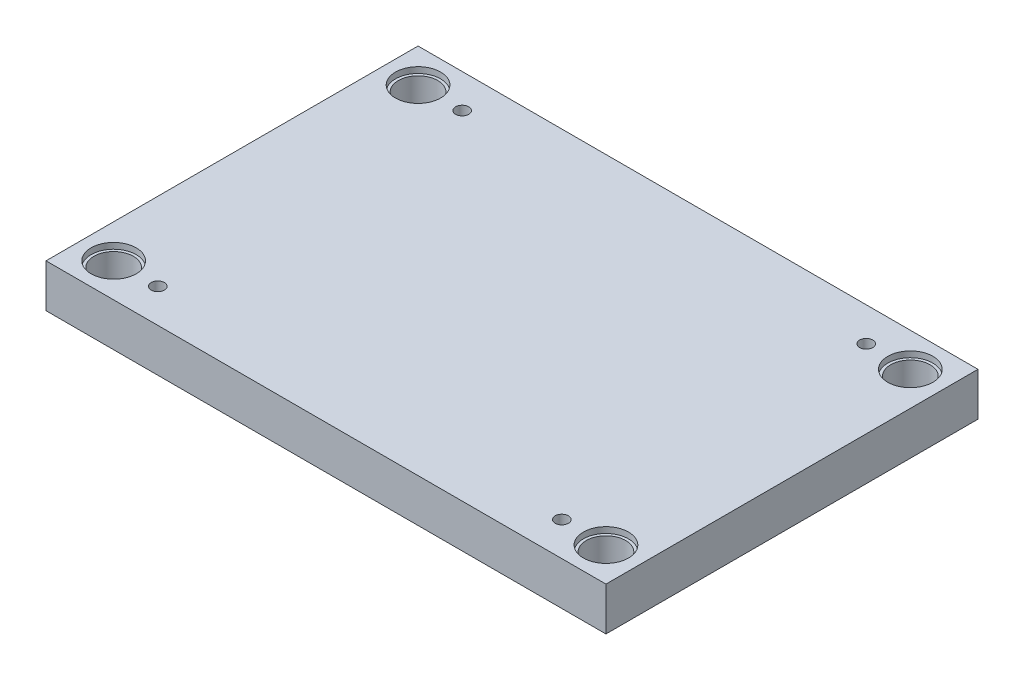
from build123d import *

# Parameters (mm, degrees)
SZKIC1_W                    = 596
SZKIC1_H                    = 396
SZKIC1_R                    = 24
SZKIC1_R_2                  = 21
DODANIE_WYCI_GNI_CIE1_DEPTH = 46
SZKIC1_3_R                  = 24
SZKIC1_3_R_2                = 21
WYTNIJ_WYCI_GNI_CIE1_DEPTH  = 6.3
OTW_R_GWINTOWANY_M161_D     = 14
OTW_R_GWINTOWANY_M161_DEPTH = 40
OTW_R_GWINTOWANY_M161_TIP   = 4.206024333
SZKIC4_W                    = 250.46
SZKIC4_H                    = 3
SZKIC4_7_W                  = 70
SZKIC4_7_H                  = 3
SZKIC9_R                    = 3
LUSTRO2_COPY_1_SKETCH_R     = 3
LUSTRO3_COPY_1_SKETCH_R     = 3
LUSTRO3_COPY_2_SKETCH_W     = 70
LUSTRO3_COPY_2_SKETCH_H     = 3
LUSTRO3_COPY_5_SKETCH_R     = 3
LUSTRO3_COPY_6_SKETCH_R     = 3
WYTNIJ_WYCI_GNI_CIE2_DEPTH  = 0.75
WYTNIJ_WYCI_GNI_CIE8_DEPTH  = 2.75
DODANIE_WYCI_GNI_CIE2_START = 11.25
SZKIC10_7_R                 = 5.5
DODANIE_WYCI_GNI_CIE2_DEPTH = 11.25
SZKIC10_8_R                 = 5
DODANIE_WYCI_GNI_CIE3_DEPTH = 6.25
ZAOKR_GLENIE1_R             = 1
ZAOKR_GLENIE1_OF_LUSTRO6_R  = 1


# Read off the part's stored shape, not the designer's step: Lustro7, Lustro8
with BuildPart() as part:
    # Szkic1 → Dodanie-wyciągnięcie1 (new body)
    # profile 1 of 5: a face of its own
    with BuildSketch(Plane(origin=(0, 0, 0), x_dir=(1, 0, 0), z_dir=(0, 1, 0))):
        with Locations((298, 198)):
            Rectangle(SZKIC1_W, SZKIC1_H)
        with Locations((560, 360)):
            Circle(SZKIC1_R, mode=Mode.SUBTRACT)
        with Locations((36, 360)):
            Circle(SZKIC1_R, mode=Mode.SUBTRACT)
        with Locations((560, 36)):
            Circle(SZKIC1_R, mode=Mode.SUBTRACT)
        with Locations((36, 36)):
            Circle(SZKIC1_R, mode=Mode.SUBTRACT)
    # profile 2 of 5: a face of its own
    with BuildSketch(Plane(origin=(0, 0, 0), x_dir=(1, 0, 0), z_dir=(0, 1, 0))):
        with Locations((36, 36)):
            Circle(SZKIC1_R)
        with Locations(Location((36, 36, 0), (0, 0, 270))):
            Circle(SZKIC1_R_2, mode=Mode.SUBTRACT)
    # profile 3 of 5: a face of its own
    with BuildSketch(Plane(origin=(0, 0, 0), x_dir=(1, 0, 0), z_dir=(0, 1, 0))):
        with Locations((560, 36)):
            Circle(SZKIC1_R)
        with Locations(Location((560, 36, 0), (0, 0, 270))):
            Circle(SZKIC1_R_2, mode=Mode.SUBTRACT)
    # profile 4 of 5: a face of its own
    with BuildSketch(Plane(origin=(0, 0, 0), x_dir=(1, 0, 0), z_dir=(0, 1, 0))):
        with Locations((560, 360)):
            Circle(SZKIC1_R)
        with Locations(Location((560, 360, 0), (0, 0, 270))):
            Circle(SZKIC1_R_2, mode=Mode.SUBTRACT)
    # profile 5 of 5: a face of its own
    with BuildSketch(Plane(origin=(0, 0, 0), x_dir=(1, 0, 0), z_dir=(0, 1, 0))):
        with Locations((36, 360)):
            Circle(SZKIC1_R)
        with Locations(Location((36, 360, 0), (0, 0, 270))):
            Circle(SZKIC1_R_2, mode=Mode.SUBTRACT)
    extrude(amount=-DODANIE_WYCI_GNI_CIE1_DEPTH)

    # Szkic1<3> → Wytnij-wyciągnięcie1 (cut)
    # profile 1 of 4: a face of its own
    with BuildSketch(Plane(origin=(0, 0, 0), x_dir=(1, 0, 0), z_dir=(0, 1, 0))):
        with Locations(Location((36, 360, 0), (0, 0, 270))):
            Circle(SZKIC1_3_R)
        with Locations(Location((36, 360, 0), (0, 0, 270))):
            Circle(SZKIC1_3_R_2, mode=Mode.SUBTRACT)
    # profile 2 of 4: a face of its own
    with BuildSketch(Plane(origin=(0, 0, 0), x_dir=(1, 0, 0), z_dir=(0, 1, 0))):
        with Locations(Location((36, 36, 0), (0, 0, 270))):
            Circle(SZKIC1_3_R)
        with Locations(Location((36, 36, 0), (0, 0, 270))):
            Circle(SZKIC1_3_R_2, mode=Mode.SUBTRACT)
    # profile 3 of 4: a face of its own
    with BuildSketch(Plane(origin=(0, 0, 0), x_dir=(1, 0, 0), z_dir=(0, 1, 0))):
        with Locations(Location((560, 36, 0), (0, 0, 270))):
            Circle(SZKIC1_3_R)
        with Locations(Location((560, 36, 0), (0, 0, 270))):
            Circle(SZKIC1_3_R_2, mode=Mode.SUBTRACT)
    # profile 4 of 4: a face of its own
    with BuildSketch(Plane(origin=(0, 0, 0), x_dir=(1, 0, 0), z_dir=(0, 1, 0))):
        with Locations(Location((560, 360, 0), (0, 0, 270))):
            Circle(SZKIC1_3_R)
        with Locations(Location((560, 360, 0), (0, 0, 270))):
            Circle(SZKIC1_3_R_2, mode=Mode.SUBTRACT)
    extrude(amount=-WYTNIJ_WYCI_GNI_CIE1_DEPTH, mode=Mode.SUBTRACT)

    # Otwór gwintowany M161
    with Locations(Plane(origin=(83, 0, -360), x_dir=(0, 0, 1), z_dir=(0, 1, 0))):
        with Locations((0, 0), (0, 430), (324, 0), (324, 430)):
            Hole(OTW_R_GWINTOWANY_M161_D / 2, depth=OTW_R_GWINTOWANY_M161_DEPTH)
            with Locations((0, 0, -(OTW_R_GWINTOWANY_M161_DEPTH + OTW_R_GWINTOWANY_M161_TIP / 2))):  # 118° drill point
                Cone(0, OTW_R_GWINTOWANY_M161_D / 2, OTW_R_GWINTOWANY_M161_TIP, mode=Mode.SUBTRACT)

    # Szkic4 → Wycięcie-obrót4 (revolve, cut)
    with BuildSketch(Plane.XZ.offset(46)):
        with Locations((298, -196.5)):
            Rectangle(SZKIC4_W, SZKIC4_H)
    revolve(axis=Axis((423.23, -46, -198), (-1, 0, 0)), mode=Mode.SUBTRACT)

    # Szkic4<6> → Wycięcie-obrót5 (revolve, cut)
    with BuildSketch(Plane.XZ.offset(46)):
        Polygon((423.23, -195), (423.23, -198), (423.23, -218), (426.23, -218), (426.23, -178), (423.23, -178), align=None)
    wyci_cie_obr_t5 = revolve(axis=Axis((423.23, -46, -218), (0, 0, 1)), mode=Mode.SUBTRACT)

    # Szkic4<7> → Wycięcie-obrót6 (revolve, cut)
    with BuildSketch(Plane.XZ.offset(46)):
        with Locations((423.23, -176.5)):
            Rectangle(SZKIC4_7_W, SZKIC4_7_H)
    wyci_cie_obr_t6 = revolve(axis=Axis((458.23, -46, -178), (-1, 0, 0)), mode=Mode.SUBTRACT)

    # Szkic4<8> → Wycięcie-obrót7 (revolve, cut)
    with BuildSketch(Plane.XZ.offset(46)):
        Polygon((380.23, -153), (382.48, -147), (383.23, -147), (383.23, -153), (383.23, -173), (380.23, -173), align=None)
    wyci_cie_obr_t7 = revolve(axis=Axis((383.23, -46, -153), (0, 0, -1)), mode=Mode.SUBTRACT)

    # Szkic4<9> → Wycięcie-obrót8 (revolve, cut)
    with BuildSketch(Plane.XZ.offset(46)):
        Polygon((466.23, -173), (463.23, -173), (463.23, -153), (463.23, -147), (463.98, -147), (466.23, -153), align=None)
    wyci_cie_obr_t8 = revolve(axis=Axis((463.23, -46, -153), (0, 0, -1)), mode=Mode.SUBTRACT)

    # Wycięcie-wyciągnięcie po ścieżce1: sweep along a path in Szkic8
    with BuildLine(Plane.XZ.offset(46)) as wyci_cie_wyci_gni_cie_po_cie_ce1_path:
        ThreePointArc((383.23, -173), (384.694466094, -176.535533906), (388.23, -178))
    # Szkic9 → Wycięcie-wyciągnięcie po ścieżce1 (sweep, cut)
    with BuildSketch(Plane(origin=(388.23, 0, 0), x_dir=(0, 0, -1), z_dir=(1, 0, 0))):
        with Locations((178, -46)):
            Circle(SZKIC9_R)
    wyci_cie_wyci_gni_cie_po_cie_ce1 = sweep(path=wyci_cie_wyci_gni_cie_po_cie_ce1_path.line, mode=Mode.SUBTRACT)

    # Lustro1: Wycięcie-wyciągnięcie po ścieżce1 across plane
    add(wyci_cie_wyci_gni_cie_po_cie_ce1.mirror(Plane(origin=(423.23, 0, 0), x_dir=(0, 0, 1), z_dir=(1, 0, 0))), mode=Mode.SUBTRACT)

    # Lustro2: Wycięcie-obrót6, Wycięcie-obrót7, Wycięcie-obrót8, Wycięcie-wyciągnięcie po ścieżce1 across plane
    add(wyci_cie_obr_t6.mirror(Plane(origin=(0, 0, -198), x_dir=(1, 0, 0), z_dir=(0, 0, -1))), mode=Mode.SUBTRACT)
    add(wyci_cie_obr_t7.mirror(Plane(origin=(0, 0, -198), x_dir=(1, 0, 0), z_dir=(0, 0, -1))), mode=Mode.SUBTRACT)
    add(wyci_cie_obr_t8.mirror(Plane(origin=(0, 0, -198), x_dir=(1, 0, 0), z_dir=(0, 0, -1))), mode=Mode.SUBTRACT)
    add(wyci_cie_wyci_gni_cie_po_cie_ce1.mirror(Plane(origin=(0, 0, -198), x_dir=(1, 0, 0), z_dir=(0, 0, -1))), mode=Mode.SUBTRACT)

    # Lustro2 copy 1: sweep along a path in Lustro2 copy 1 path
    with BuildLine(Plane(origin=(846.46, -46, -396), x_dir=(-1, 0, 0), z_dir=(0, -1, 0))) as lustro2_copy_1_path:
        ThreePointArc((383.23, -173), (384.694466094, -176.535533906), (388.23, -178))
    # Lustro2 copy 1 sketch → Lustro2 copy 1 (sweep, cut)
    with BuildSketch(Plane(origin=(458.23, 0, -396), x_dir=(0, 0, 1), z_dir=(-1, 0, 0))):
        with Locations((178, -46)):
            Circle(LUSTRO2_COPY_1_SKETCH_R)
    sweep(path=lustro2_copy_1_path.line, mode=Mode.SUBTRACT)

    # Lustro3: Wycięcie-obrót5, Wycięcie-obrót6, Wycięcie-obrót7, Wycięcie-obrót8, Wycięcie-wyciągnięcie po ścieżce1 across plane
    add(wyci_cie_obr_t5.mirror(Plane.ZY.offset(-298)), mode=Mode.SUBTRACT)
    add(wyci_cie_obr_t6.mirror(Plane.ZY.offset(-298)), mode=Mode.SUBTRACT)
    add(wyci_cie_obr_t7.mirror(Plane.ZY.offset(-298)), mode=Mode.SUBTRACT)
    add(wyci_cie_obr_t8.mirror(Plane.ZY.offset(-298)), mode=Mode.SUBTRACT)
    add(wyci_cie_wyci_gni_cie_po_cie_ce1.mirror(Plane.ZY.offset(-298)), mode=Mode.SUBTRACT)

    # Lustro3 copy 1: sweep along a path in Lustro3 copy 1 path
    with BuildLine(Plane(origin=(-250.46, -46, 0), x_dir=(1, 0, 0), z_dir=(0, -1, 0))) as lustro3_copy_1_path:
        ThreePointArc((383.23, -173), (384.694466094, -176.535533906), (388.23, -178))
    # Lustro3 copy 1 sketch → Lustro3 copy 1 (sweep, cut)
    with BuildSketch(Plane(origin=(137.77, 0, 0), x_dir=(0, 0, -1), z_dir=(1, 0, 0))):
        with Locations((178, -46)):
            Circle(LUSTRO3_COPY_1_SKETCH_R)
    sweep(path=lustro3_copy_1_path.line, mode=Mode.SUBTRACT)

    # Lustro3 copy 2 sketch → Lustro3 copy 2 (revolve, cut)
    with BuildSketch(Plane(origin=(596, -46, -396), x_dir=(-1, 0, 0), z_dir=(0, -1, 0))):
        with Locations((423.23, -176.5)):
            Rectangle(LUSTRO3_COPY_2_SKETCH_W, LUSTRO3_COPY_2_SKETCH_H)
    revolve(axis=Axis((137.77, -46, -218), (1, 0, 0)), mode=Mode.SUBTRACT)

    # Lustro3 copy 3 sketch → Lustro3 copy 3 (revolve, cut)
    with BuildSketch(Plane(origin=(596, -46, -396), x_dir=(-1, 0, 0), z_dir=(0, -1, 0))):
        Polygon((380.23, -153), (382.48, -147), (383.23, -147), (383.23, -153), (383.23, -173), (380.23, -173), align=None)
    revolve(axis=Axis((212.77, -46, -243), (0, 0, 1)), mode=Mode.SUBTRACT)

    # Lustro3 copy 4 sketch → Lustro3 copy 4 (revolve, cut)
    with BuildSketch(Plane(origin=(596, -46, -396), x_dir=(-1, 0, 0), z_dir=(0, -1, 0))):
        Polygon((466.23, -173), (463.23, -173), (463.23, -153), (463.23, -147), (463.98, -147), (466.23, -153), align=None)
    revolve(axis=Axis((132.77, -46, -243), (0, 0, 1)), mode=Mode.SUBTRACT)

    # Lustro3 copy 5: sweep along a path in Lustro3 copy 5 path
    with BuildLine(Plane(origin=(596, -46, -396), x_dir=(-1, 0, 0), z_dir=(0, -1, 0))) as lustro3_copy_5_path:
        ThreePointArc((383.23, -173), (384.694466094, -176.535533906), (388.23, -178))
    # Lustro3 copy 5 sketch → Lustro3 copy 5 (sweep, cut)
    with BuildSketch(Plane(origin=(207.77, 0, -396), x_dir=(0, 0, 1), z_dir=(-1, 0, 0))):
        with Locations((178, -46)):
            Circle(LUSTRO3_COPY_5_SKETCH_R)
    sweep(path=lustro3_copy_5_path.line, mode=Mode.SUBTRACT)

    # Lustro3 copy 6: sweep along a path in Lustro3 copy 6 path
    with BuildLine(Plane(origin=(-250.46, -46, -396), x_dir=(1, 0, 0), z_dir=(0, -1, 0))) as lustro3_copy_6_path:
        ThreePointArc((383.23, 173), (384.694466094, 176.535533906), (388.23, 178))
    # Lustro3 copy 6 sketch → Lustro3 copy 6 (sweep, cut)
    with BuildSketch(Plane(origin=(137.77, 0, -396), x_dir=(0, 0, 1), z_dir=(1, 0, 0))):
        with Locations((178, 46)):
            Circle(LUSTRO3_COPY_6_SKETCH_R)
    sweep(path=lustro3_copy_6_path.line, mode=Mode.SUBTRACT)

    # Szkic10 → Wytnij-wyciągnięcie2 (cut)
    with BuildSketch(Plane(origin=(0, -46, 0), x_dir=(-1, 0, 0), z_dir=(0, -1, 0))):
        with BuildLine():
            Line((-483.73, 257.65), (-483.73, 310.35))
            ThreePointArc((-483.73, 310.35), (-481.196473657, 316.466473657), (-475.08, 319))
            Line((-475.08, 319), (-451.38, 319))
            ThreePointArc((-451.38, 319), (-445.263526343, 316.466473657), (-442.73, 310.35))
            Line((-442.73, 310.35), (-442.73, 257.65))
            ThreePointArc((-442.73, 257.65), (-445.263526343, 251.533526343), (-451.38, 249))
            Line((-451.38, 249), (-475.08, 249))
            ThreePointArc((-475.08, 249), (-481.196473657, 251.533526343), (-483.73, 257.65))
        make_face()
        with BuildLine():
            Line((-475.08, 249.5), (-451.38, 249.5))
            ThreePointArc((-451.38, 249.5), (-445.617079733, 251.887079733), (-443.23, 257.65))
            Line((-443.23, 257.65), (-443.23, 310.35))
            ThreePointArc((-443.23, 310.35), (-445.617079733, 316.112920267), (-451.38, 318.5))
            Line((-451.38, 318.5), (-475.08, 318.5))
            ThreePointArc((-475.08, 318.5), (-480.842920267, 316.112920267), (-483.23, 310.35))
            Line((-483.23, 310.35), (-483.23, 257.65))
            ThreePointArc((-483.23, 257.65), (-480.842920267, 251.887079733), (-475.08, 249.5))
        make_face(mode=Mode.SUBTRACT)
    wytnij_wyci_gni_cie2 = extrude(amount=-WYTNIJ_WYCI_GNI_CIE2_DEPTH, mode=Mode.SUBTRACT)

    # Szkic10<6> → Wytnij-wyciągnięcie8 (cut)
    with BuildSketch(Plane(origin=(0, -46, 0), x_dir=(-1, 0, 0), z_dir=(0, -1, 0))):
        with BuildLine():
            ThreePointArc((-451.38, 318.5), (-445.617079733, 316.112920267), (-443.23, 310.35))
            Line((-443.23, 310.35), (-443.23, 257.65))
            ThreePointArc((-443.23, 257.65), (-445.617079733, 251.887079733), (-451.38, 249.5))
            Line((-451.38, 249.5), (-475.08, 249.5))
            ThreePointArc((-475.08, 249.5), (-480.842920267, 251.887079733), (-483.23, 257.65))
            Line((-483.23, 257.65), (-483.23, 310.35))
            ThreePointArc((-483.23, 310.35), (-480.842920267, 316.112920267), (-475.08, 318.5))
            Line((-475.08, 318.5), (-451.38, 318.5))
        make_face()
        with BuildLine():
            Line((-475.08, 317.5), (-451.38, 317.5))
            ThreePointArc((-451.38, 317.5), (-446.324186515, 315.405813485), (-444.23, 310.35))
            Line((-444.23, 310.35), (-444.23, 257.65))
            ThreePointArc((-444.23, 257.65), (-446.324186515, 252.594186515), (-451.38, 250.5))
            Line((-451.38, 250.5), (-475.08, 250.5))
            ThreePointArc((-475.08, 250.5), (-480.135813485, 252.594186515), (-482.23, 257.65))
            Line((-482.23, 257.65), (-482.23, 310.35))
            ThreePointArc((-482.23, 310.35), (-480.135813485, 315.405813485), (-475.08, 317.5))
        make_face(mode=Mode.SUBTRACT)
    wytnij_wyci_gni_cie8 = extrude(amount=-WYTNIJ_WYCI_GNI_CIE8_DEPTH, mode=Mode.SUBTRACT)

    # Szkic10<7> → Dodanie-wyciągnięcie2 (add)
    with BuildSketch(Plane(origin=(0, -46, 0), x_dir=(-1, 0, 0), z_dir=(0, -1, 0)).offset(DODANIE_WYCI_GNI_CIE2_START)):
        with BuildLine():
            ThreePointArc((-451.38, 317.5), (-446.324186515, 315.405813485), (-444.23, 310.35))
            Line((-444.23, 310.35), (-444.23, 257.65))
            ThreePointArc((-444.23, 257.65), (-446.324186515, 252.594186515), (-451.38, 250.5))
            Line((-451.38, 250.5), (-475.08, 250.5))
            ThreePointArc((-475.08, 250.5), (-480.135813485, 252.594186515), (-482.23, 257.65))
            Line((-482.23, 257.65), (-482.23, 310.35))
            ThreePointArc((-482.23, 310.35), (-480.135813485, 315.405813485), (-475.08, 317.5))
            Line((-475.08, 317.5), (-451.38, 317.5))
        make_face()
        with Locations(Location((-463.23, 261.5, 0), (0, 0, 270))):
            Circle(SZKIC10_7_R, mode=Mode.SUBTRACT)
    dodanie_wyci_gni_cie2 = extrude(amount=-DODANIE_WYCI_GNI_CIE2_DEPTH)

    # Szkic10<8> → Dodanie-wyciągnięcie3 (add)
    with BuildSketch(Plane(origin=(0, -46, 0), x_dir=(-1, 0, 0), z_dir=(0, -1, 0))):
        with Locations(Location((-463.23, 261.5, 0), (0, 0, 270))):
            Circle(SZKIC10_8_R)
    dodanie_wyci_gni_cie3 = extrude(amount=DODANIE_WYCI_GNI_CIE3_DEPTH)

    # Zaokrąglenie1
    zaokr_glenie1_edges = [part.edges().sort_by_distance(p)[0] for p in [
        (446.324186515, -57.25, -315.405813485),
        (463.23, -57.25, -317.5),
        (482.23, -57.25, -284),
        (446.324186515, -57.25, -252.594186515),
        (480.135813485, -57.25, -315.405813485),
        (480.135813485, -57.25, -252.594186515),
        (463.23, -57.25, -250.5),
        (444.23, -57.25, -284),
    ]]
    fillet(zaokr_glenie1_edges, radius=ZAOKR_GLENIE1_R)

    # Lustro6: Wytnij-wyciągnięcie2, Wytnij-wyciągnięcie8, Dodanie-wyciągnięcie2, Dodanie-wyciągnięcie3 across plane
    add(wytnij_wyci_gni_cie2.mirror(Plane(origin=(423.23, 0, 0), x_dir=(0, 0, 1), z_dir=(1, 0, 0))), mode=Mode.SUBTRACT)
    add(wytnij_wyci_gni_cie8.mirror(Plane(origin=(423.23, 0, 0), x_dir=(0, 0, 1), z_dir=(1, 0, 0))), mode=Mode.SUBTRACT)
    add(dodanie_wyci_gni_cie2.mirror(Plane(origin=(423.23, 0, 0), x_dir=(0, 0, 1), z_dir=(1, 0, 0))))
    add(dodanie_wyci_gni_cie3.mirror(Plane(origin=(423.23, 0, 0), x_dir=(0, 0, 1), z_dir=(1, 0, 0))))

    # Zaokrąglenie1 of Lustro6
    zaokr_glenie1_of_lustro6_edges = [part.edges().sort_by_distance(p)[0] for p in [
        (400.135813485, -57.25, -315.405813485),
        (383.23, -57.25, -317.5),
        (364.23, -57.25, -284),
        (400.135813485, -57.25, -252.594186515),
        (366.324186515, -57.25, -315.405813485),
        (366.324186515, -57.25, -252.594186515),
        (383.23, -57.25, -250.5),
        (402.23, -57.25, -284),
    ]]
    fillet(zaokr_glenie1_of_lustro6_edges, radius=ZAOKR_GLENIE1_OF_LUSTRO6_R)

    # Lustro7
    split(bisect_by=Plane(origin=(0, 0, -198), x_dir=(1, 0, 0), z_dir=(0, 0, -1)), keep=Keep.TOP)

    # Lustro7 2: part across plane


with BuildPart() as part_1:
    add(part.part)
    add(part.part.mirror(Plane(origin=(0, 0, -198), x_dir=(1, 0, 0), z_dir=(0, 0, -1))))

    # Lustro8
    split(bisect_by=Plane.ZY.offset(-298), keep=Keep.BOTTOM)

    # Lustro8 2: part across plane


with BuildPart() as part_2:
    add(part_1.part)
    add(part_1.part.mirror(Plane.ZY.offset(-298)))


solid = part_2.part
